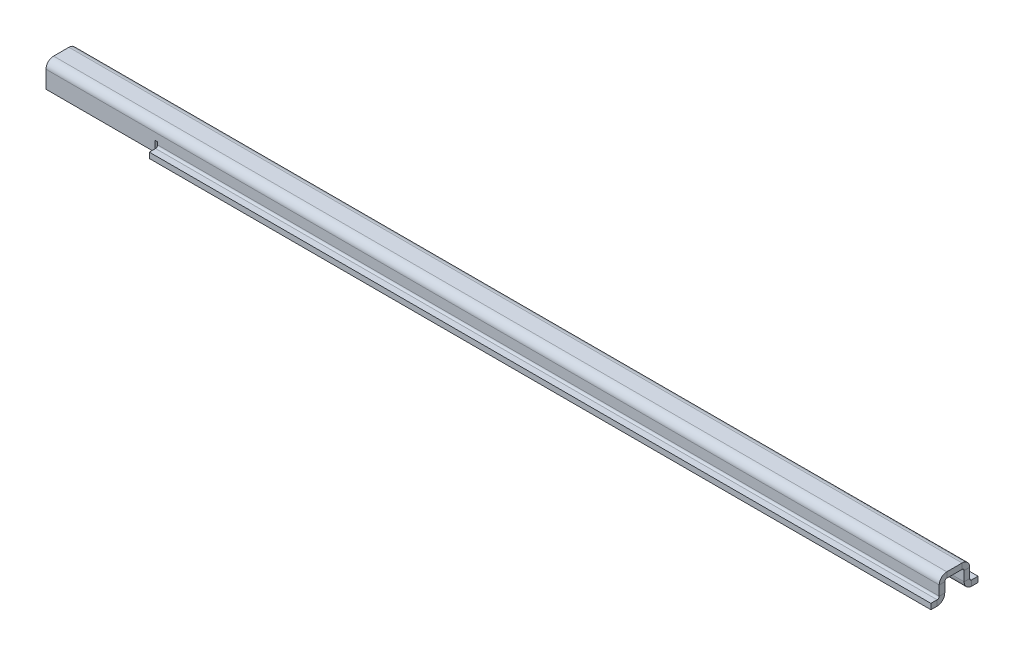
from build123d import *

# Parameters (mm, degrees)
SKETCH2_W                       = 322.4
SKETCH2_H                       = 11
BASE_FLANGE1_DEPTH              = 2
EDGE_FLANGE1_STRIP_W            = 9.4732
EDGE_FLANGE1_STRIP_H            = 2
EDGE_FLANGE1_STRIP_CUT_DEPTH    = 322.4
EDGE_FLANGE1_STRIP_2_W          = 9.4732
EDGE_FLANGE1_STRIP_2_H          = 2
EDGE_FLANGE1_STRIP_CUT_2_DEPTH  = 322.4
EDGE_FLANGE1_DEPTH              = 322.4
EDGE_FLANGE1_BEND_DEPTH         = 322.4
EDGE_FLANGE3_STRIP_W            = 9.4732
EDGE_FLANGE3_STRIP_H            = 2
EDGE_FLANGE3_STRIP_CUT_DEPTH    = 282.1
EDGE_FLANGE3_RELIEF_W           = 10.4732
EDGE_FLANGE3_RELIEF_H           = 1
EDGE_FLANGE3_RELIEF_CUT_DEPTH   = 2
EDGE_FLANGE3_STRIP_2_W          = 9.4732
EDGE_FLANGE3_STRIP_2_H          = 2
EDGE_FLANGE3_STRIP_CUT_2_DEPTH  = 282.1
EDGE_FLANGE3_RELIEF_2_W         = 10.4732
EDGE_FLANGE3_RELIEF_2_H         = 1
EDGE_FLANGE3_RELIEF_CUT_2_DEPTH = 2
EDGE_FLANGE3_DEPTH              = 282.1
EDGE_FLANGE3_BEND_DEPTH         = 282.1


# Sheet-metal steps are written as plain solids
with BuildPart() as part:
    # Sketch2 → Base-Flange1 (new body)
    with BuildSketch(Plane(origin=(0, 0, 0), x_dir=(1, 0, 0), z_dir=(0, 1, 0))):
        Rectangle(SKETCH2_W, SKETCH2_H)
    extrude(amount=-BASE_FLANGE1_DEPTH)

    # Edge-Flange1 strip (across the edge) → Edge-Flange1 strip cut (cut)
    with BuildSketch(Plane(origin=(161.2, -2, 5.5), x_dir=(0, 0, -1), z_dir=(-1, 0, 0))):
        with Locations((-2, -1)):
            Rectangle(EDGE_FLANGE1_STRIP_W, EDGE_FLANGE1_STRIP_H)
    extrude(amount=EDGE_FLANGE1_STRIP_CUT_DEPTH, mode=Mode.SUBTRACT)

    # Edge-Flange1 strip 2 (across the edge) → Edge-Flange1 strip cut 2 (cut)
    with BuildSketch(Plane(origin=(-161.2, -2, -5.5), x_dir=(0, 0, 1), z_dir=(1, 0, 0))):
        with Locations((-2, -1)):
            Rectangle(EDGE_FLANGE1_STRIP_2_W, EDGE_FLANGE1_STRIP_2_H)
    extrude(amount=EDGE_FLANGE1_STRIP_CUT_2_DEPTH, mode=Mode.SUBTRACT)

    # Edge-Flange1 section (across the edge) → Edge-Flange1 (add)
    with BuildSketch(Plane(origin=(161.2, -2, 5.5), x_dir=(0, 0, -1), z_dir=(-1, 0, 0))):
        with BuildLine():
            Line((0, 0.7366), (0, 7))
            Line((0, 7), (2, 7))
            Line((2, 7), (2, 0.7366))
            ThreePointArc((2, 0.7366), (2.215745145, 0.215745145), (2.7366, 0))
            Line((2.7366, 0), (2.7366, -2))
            ThreePointArc((2.7366, -2), (0.801531583, -1.198468417), (0, 0.7366))
        make_face()
    extrude(amount=EDGE_FLANGE1_DEPTH)

    # Edge-Flange1 section 2 (across the edge) → Edge-Flange1 bend (add)
    with BuildSketch(Plane(origin=(-161.2, -2, -5.5), x_dir=(0, 0, 1), z_dir=(1, 0, 0))):
        with BuildLine():
            Line((0, 0.7366), (0, 7))
            Line((0, 7), (2, 7))
            Line((2, 7), (2, 0.7366))
            ThreePointArc((2, 0.7366), (2.215745145, 0.215745145), (2.7366, 0))
            Line((2.7366, 0), (2.7366, -2))
            ThreePointArc((2.7366, -2), (0.801531583, -1.198468417), (0, 0.7366))
        make_face()
    extrude(amount=EDGE_FLANGE1_BEND_DEPTH)

    # Edge-Flange3 strip (across the edge) → Edge-Flange3 strip cut (cut)
    with BuildSketch(Plane(origin=(-120.9, -9, 5.5), x_dir=(0, 1, 0), z_dir=(1, 0, 0))):
        with Locations((-2, -1)):
            Rectangle(EDGE_FLANGE3_STRIP_W, EDGE_FLANGE3_STRIP_H)
    extrude(amount=EDGE_FLANGE3_STRIP_CUT_DEPTH, mode=Mode.SUBTRACT)

    # Edge-Flange3 relief (on the sheet) → Edge-Flange3 relief cut (cut)
    with BuildSketch(Plane(origin=(-120.9, -6.2634, 5.5), x_dir=(0, 1, 0), z_dir=(0, 0, 1))):
        with Locations((-4.2366, 0.5)):
            Rectangle(EDGE_FLANGE3_RELIEF_W, EDGE_FLANGE3_RELIEF_H)
    extrude(amount=-EDGE_FLANGE3_RELIEF_CUT_DEPTH, mode=Mode.SUBTRACT)

    # Edge-Flange3 strip 2 (across the edge) → Edge-Flange3 strip cut 2 (cut)
    with BuildSketch(Plane(origin=(161.2, -9, -5.5), x_dir=(0, 1, 0), z_dir=(-1, 0, 0))):
        with Locations((-2, -1)):
            Rectangle(EDGE_FLANGE3_STRIP_2_W, EDGE_FLANGE3_STRIP_2_H)
    extrude(amount=EDGE_FLANGE3_STRIP_CUT_2_DEPTH, mode=Mode.SUBTRACT)

    # Edge-Flange3 relief 2 (on the sheet) → Edge-Flange3 relief cut 2 (cut)
    with BuildSketch(Plane(origin=(161.2, -6.2634, -5.5), x_dir=(0, 1, 0), z_dir=(0, 0, -1))):
        with Locations((-4.2366, -282.6)):
            Rectangle(EDGE_FLANGE3_RELIEF_2_W, EDGE_FLANGE3_RELIEF_2_H)
    extrude(amount=-EDGE_FLANGE3_RELIEF_CUT_2_DEPTH, mode=Mode.SUBTRACT)

    # Edge-Flange3 section (across the edge) → Edge-Flange3 (add)
    with BuildSketch(Plane(origin=(-120.9, -9, 5.5), x_dir=(0, 1, 0), z_dir=(1, 0, 0))):
        with BuildLine():
            Line((0, 0.7366), (0, 3))
            Line((0, 3), (2, 3))
            Line((2, 3), (2, 0.7366))
            ThreePointArc((2, 0.7366), (2.215745145, 0.215745145), (2.7366, 0))
            Line((2.7366, 0), (2.7366, -2))
            ThreePointArc((2.7366, -2), (0.801531583, -1.198468417), (0, 0.7366))
        make_face()
    extrude(amount=EDGE_FLANGE3_DEPTH)

    # Edge-Flange3 section 2 (across the edge) → Edge-Flange3 bend (add)
    with BuildSketch(Plane(origin=(161.2, -9, -5.5), x_dir=(0, 1, 0), z_dir=(-1, 0, 0))):
        with BuildLine():
            Line((0, 0.7366), (0, 3))
            Line((0, 3), (2, 3))
            Line((2, 3), (2, 0.7366))
            ThreePointArc((2, 0.7366), (2.215745145, 0.215745145), (2.7366, 0))
            Line((2.7366, 0), (2.7366, -2))
            ThreePointArc((2.7366, -2), (0.801531583, -1.198468417), (0, 0.7366))
        make_face()
    extrude(amount=EDGE_FLANGE3_BEND_DEPTH)


solid = part.part
